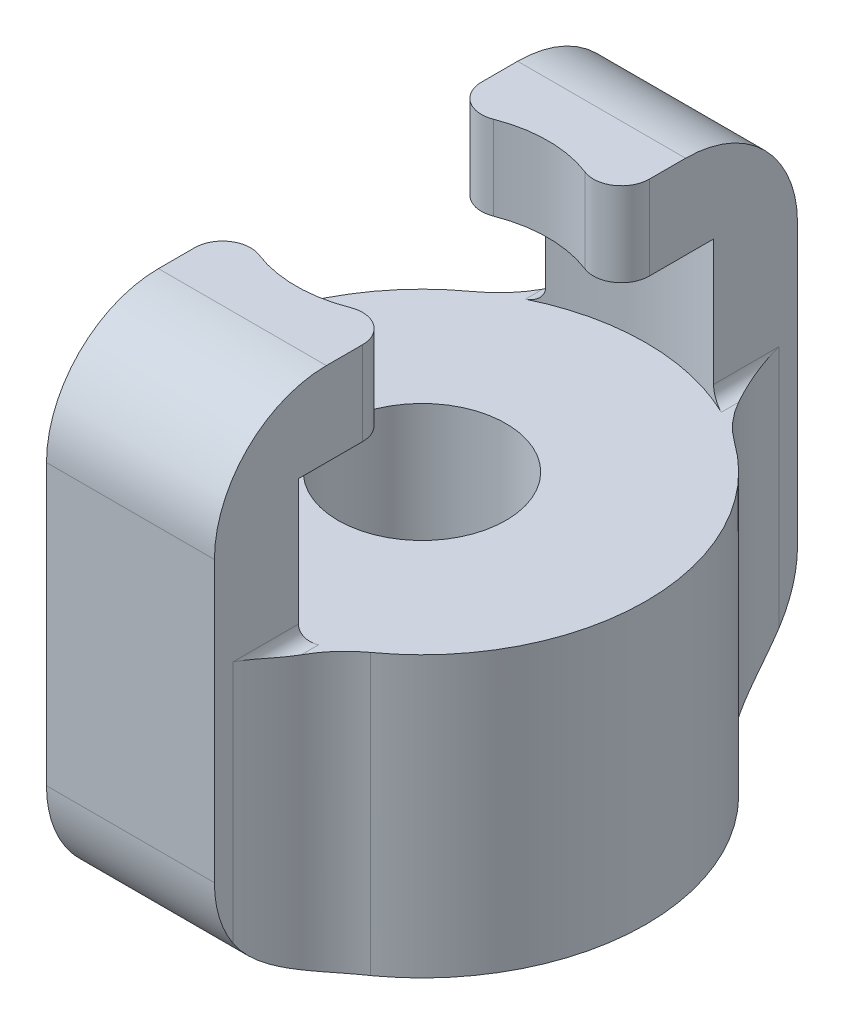
from build123d import *

# Parameters (mm, degrees)
SKETCH1_R           = 8
SKETCH1_R_2         = 3
BOSS_EXTRUDE1_DEPTH = 10
BOSS_EXTRUDE2_DEPTH = 15
BOSS_EXTRUDE3_DEPTH = 3
FILLET1_R           = 4
FILLET2_R           = 4
FILLET3_R           = 0.5
FILLET4_R           = 1


with BuildPart() as part:
    # Sketch1 → Boss-Extrude1 (new body)
    with BuildSketch(Plane(origin=(0, 0, 0), x_dir=(1, 0, 0), z_dir=(0, 1, 0))):
        with Locations((-42.590141196, -5.023885001)):
            Circle(SKETCH1_R)
        with Locations((-42.590141196, -5.023885001)):
            Circle(SKETCH1_R_2, mode=Mode.SUBTRACT)
    extrude(amount=BOSS_EXTRUDE1_DEPTH)

    # Sketch2 → Boss-Extrude2 (add)
    with BuildSketch(Plane(origin=(0, 0, 0), x_dir=(1, 0, 0), z_dir=(0, 1, 0))):
        with BuildLine():
            Line((-39.590141196, -12.440083488), (-39.590141196, -15.440083488))
            Line((-39.590141196, -15.440083488), (-45.590141196, -15.440083488))
            Line((-45.590141196, -15.440083488), (-45.590141196, -12.440083488))
            ThreePointArc((-45.590141196, -12.440083488), (-42.590141196, -13.023885001), (-39.590141196, -12.440083488))
        make_face()
        with BuildLine():
            Line((-45.590141196, 5.392313486), (-45.590141196, 2.392313486))
            ThreePointArc((-45.590141196, 2.392313486), (-42.590141196, 2.976114999), (-39.590141196, 2.392313486))
            Line((-39.590141196, 2.392313486), (-39.590141196, 5.392313486))
            Line((-39.590141196, 5.392313486), (-45.590141196, 5.392313486))
        make_face()
    extrude(amount=BOSS_EXTRUDE2_DEPTH)

    # Sketch3 → Boss-Extrude3 (add)
    with BuildSketch(Plane(origin=(0, 15, 0), x_dir=(1, 0, 0), z_dir=(0, 1, 0))):
        with BuildLine():
            Line((-39.590141196, -15.440083488), (-45.590141196, -15.440083488))
            Line((-45.590141196, -15.440083488), (-45.590141196, -8.377986967))
            ThreePointArc((-45.590141196, -8.377986967), (-42.590141196, -9.523885001), (-39.590141196, -8.377986967))
            Line((-39.590141196, -8.377986967), (-39.590141196, -15.440083488))
        make_face()
        with BuildLine():
            Line((-45.590141196, 5.392313486), (-45.590141196, -1.669783034))
            ThreePointArc((-45.590141196, -1.669783034), (-42.590141196, -0.523885001), (-39.590141196, -1.669783034))
            Line((-39.590141196, -1.669783034), (-39.590141196, 5.392313486))
            Line((-39.590141196, 5.392313486), (-45.590141196, 5.392313486))
        make_face()
    extrude(amount=BOSS_EXTRUDE3_DEPTH)

    # Fillet1
    fillet1_edges = [part.edges().sort_by_distance(p)[0] for p in [
        (-39.590141196, 5, -2.392313486),
        (-39.590141196, 5, 12.440083488),
        (-45.590141196, 5, 12.440083488),
        (-45.590141196, 5, -2.392313486),
    ]]
    fillet(fillet1_edges, radius=FILLET1_R)

    # Fillet2
    fillet2_edges = [part.edges().sort_by_distance(p)[0] for p in [
        (-42.590141196, 18, 15.440083488),
        (-42.590141196, 18, -5.392313486),
        (-42.590141196, 0, -5.392313486),
        (-42.590141196, 0, 15.440083488),
    ]]
    fillet(fillet2_edges, radius=FILLET2_R)

    # Fillet3
    fillet3_edges = [part.edges().sort_by_distance(p)[0] for p in [
        (-39.590141196, 10, 13.605381417),
        (-45.590141196, 10, 13.605381417),
        (-45.590141196, 10, -3.557611415),
        (-39.590141196, 10, -3.557611415),
    ]]
    fillet(fillet3_edges, radius=FILLET3_R)

    # Fillet4
    fillet4_edges = [part.edges().sort_by_distance(p)[0] for p in [
        (-39.590141196, 16.5, 8.377986967),
        (-45.590141196, 16.5, 8.377986967),
        (-39.590141196, 16.5, 1.669783034),
        (-45.590141196, 16.5, 1.669783034),
    ]]
    fillet(fillet4_edges, radius=FILLET4_R)


solid = part.part
